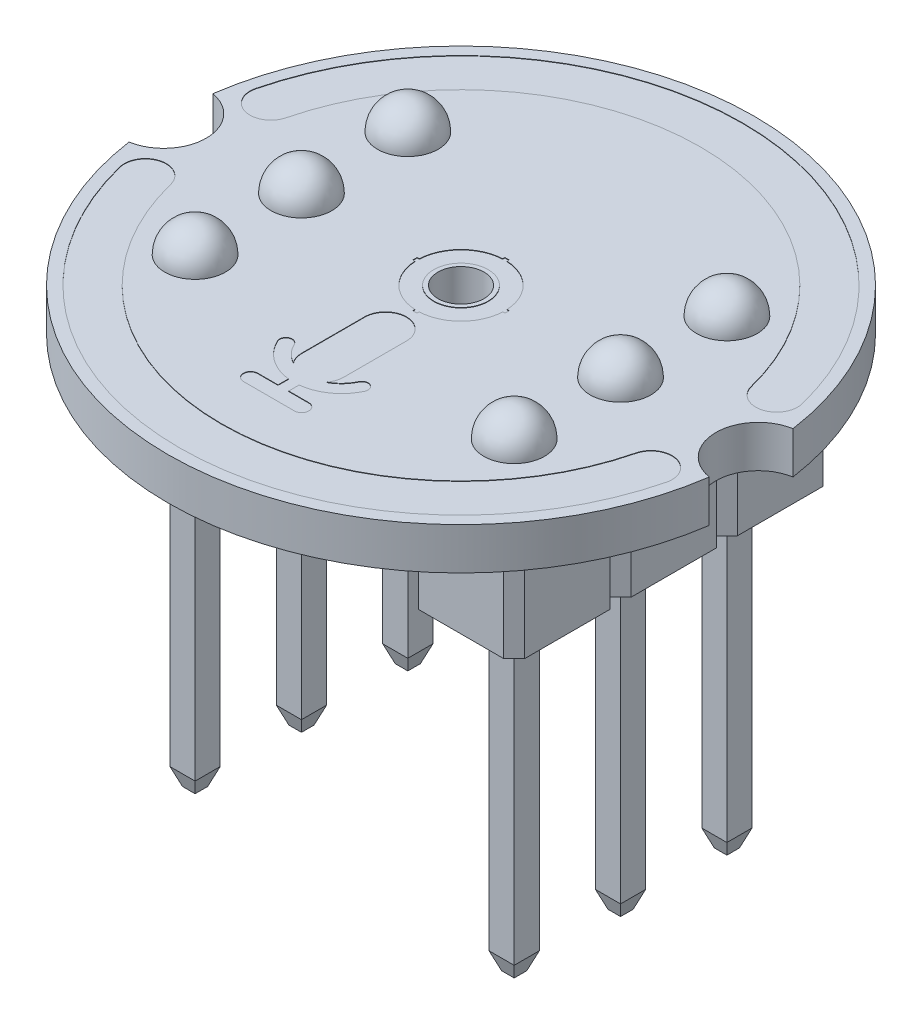
from build123d import *
from OCP.BRepFilletAPI import BRepFilletAPI_MakeChamfer

# Parameters (mm, degrees)
SKETCH_1_R          = 0.55
EXTRUDE_1_DEPTH     = 1
SKETCH_2_R          = 0.65
CUT_EXTRUDE_1_DEPTH = 0.01
SKETCH_3_R          = 0.725
EXTRUDE_2_DEPTH     = 0.725
FILLET_1_R          = 0.725
CUT_EXTRUDE_2_DEPTH = 0.01
EXTRUDE_3_DEPTH     = 2.4
SKETCH_6_W          = 1.84
SKETCH_6_H          = 0.2
CUT_EXTRUDE_3_DEPTH = 14.062009799
EXTRUDE_START       = -2.4
SKETCH_7_W          = 0.6
SKETCH_7_H          = 0.6
EXTRUDE_4_DEPTH     = 10
CHAMFER_1_SIZE      = 0.15
CHAMFER_1_SIZE2     = 0.412121613
SKETCH_9_W          = 3.75
SKETCH_9_H          = 4.75
EXTRUDE_5_DEPTH     = 0.2
FILLET_2_R          = 0.2
SKETCH_11_W         = 2.95
SKETCH_11_H         = 3.95
EXTRUDE_6_DEPTH     = 0.3
FILLET_3_R          = 0.4
SKETCH_12_W         = 1.8
SKETCH_12_H         = 0.8
EXTRUDE_7_DEPTH     = 0.6


with BuildPart() as part:
    # Эскиз1 → Бобышка-Вытянуть1 (new body)
    with BuildSketch(Plane(origin=(0, 0, 0), x_dir=(1, 0, 0), z_dir=(0, 1, 0))):
        with BuildLine():
            ThreePointArc((-6.92820323, -1), (0, -7), (6.92820323, -1))
            ThreePointArc((6.92820323, -1), (6.085350243, 0), (6.92820323, 1))
            ThreePointArc((6.92820323, 1), (0, 7), (-6.92820323, 1))
            ThreePointArc((-6.92820323, 1), (-6.085350243, 0), (-6.92820323, -1))
        make_face()
        with Locations(Location((0, 0, 0), (0, 0, 270))):
            Circle(SKETCH_1_R, mode=Mode.SUBTRACT)
    extrude(amount=EXTRUDE_1_DEPTH)

    # Эскиз2 → Вырез-Вытянуть1 (cut)
    # profile 1 of 3: a face of its own
    with BuildSketch(Plane(origin=(0, 1, 0), x_dir=(1, 0, 0), z_dir=(0, 1, 0))):
        with BuildLine():
            ThreePointArc((-6.523958913, -1.620535852), (-6.159241111, -1.014746346), (-5.553451606, -1.379464148))
            ThreePointArc((-5.553451606, -1.379464148), (0, -5.722215137), (5.553451606, -1.379464148))
            ThreePointArc((5.553451606, -1.379464148), (6.159241111, -1.014746346), (6.523958913, -1.620535852))
            ThreePointArc((6.523958913, -1.620535852), (0, -6.722215137), (-6.523958913, -1.620535852))
        make_face()
    # profile 2 of 3: a face of its own
    with BuildSketch(Plane(origin=(0, 1, 0), x_dir=(1, 0, 0), z_dir=(0, 1, 0))):
        with BuildLine():
            ThreePointArc((6.523958913, 1.620535852), (0, 6.722215137), (-6.523958913, 1.620535852))
            ThreePointArc((-6.523958913, 1.620535852), (-6.159241111, 1.014746346), (-5.553451606, 1.379464148))
            ThreePointArc((-5.553451606, 1.379464148), (0, 5.722215137), (5.553451606, 1.379464148))
            ThreePointArc((5.553451606, 1.379464148), (6.159241111, 1.014746346), (6.523958913, 1.620535852))
        make_face()
    # profile 3 of 3: a face of its own
    with BuildSketch(Plane(origin=(0, 1, 0), x_dir=(1, 0, 0), z_dir=(0, 1, 0))):
        with BuildLine():
            Line((0.05, -1.048808848), (0.05, -1.1))
            Line((0.05, -1.1), (-0.05, -1.1))
            Line((-0.05, -1.1), (-0.05, -1.048808848))
            ThreePointArc((-0.05, -1.048808848), (-0.74246212, -0.74246212), (-1.048808848, -0.05))
            Line((-1.048808848, -0.05), (-1.1, -0.05))
            Line((-1.1, -0.05), (-1.1, 0.05))
            Line((-1.1, 0.05), (-1.048808848, 0.05))
            ThreePointArc((-1.048808848, 0.05), (-0.74246212, 0.74246212), (-0.05, 1.048808848))
            Line((-0.05, 1.048808848), (-0.05, 1.1))
            Line((-0.05, 1.1), (0.05, 1.1))
            Line((0.05, 1.1), (0.05, 1.048808848))
            ThreePointArc((0.05, 1.048808848), (0.74246212, 0.74246212), (1.048808848, 0.05))
            Line((1.048808848, 0.05), (1.1, 0.05))
            Line((1.1, 0.05), (1.1, -0.05))
            Line((1.1, -0.05), (1.048808848, -0.05))
            ThreePointArc((1.048808848, -0.05), (0.74246212, -0.74246212), (0.05, -1.048808848))
        make_face()
        with Locations(Location((0, 0, 0), (0, 0, 270))):
            Circle(SKETCH_2_R, mode=Mode.SUBTRACT)
    extrude(amount=-CUT_EXTRUDE_1_DEPTH, mode=Mode.SUBTRACT)

    # Эскиз3 → Бобышка-Вытянуть2 (add)
    with BuildSketch(Plane(origin=(0, 1, 0), x_dir=(1, 0, 0), z_dir=(0, 1, 0))):
        with Locations(Location((-3.81, 2.54, 0), (0, 0, 270))):
            Circle(SKETCH_3_R)
        with Locations(Location((-3.81, 0, 0), (0, 0, 270))):
            Circle(SKETCH_3_R)
        with Locations(Location((-3.81, -2.54, 0), (0, 0, 270))):
            Circle(SKETCH_3_R)
        with Locations(Location((3.81, 2.54, 0), (0, 0, 270))):
            Circle(SKETCH_3_R)
        with Locations(Location((3.81, 0, 0), (0, 0, 270))):
            Circle(SKETCH_3_R)
        with Locations(Location((3.81, -2.54, 0), (0, 0, 270))):
            Circle(SKETCH_3_R)
    extrude(amount=EXTRUDE_2_DEPTH)

    # Скругление1
    fillet_1_edges = [part.edges().sort_by_distance(p)[0] for p in [
        (3.81, 1.725, -3.265),
        (3.81, 1.725, -0.725),
        (3.81, 1.725, 1.815),
        (-3.81, 1.725, -3.265),
        (-3.81, 1.725, -0.725),
        (-3.81, 1.725, 1.815),
    ]]
    fillet(fillet_1_edges, radius=FILLET_1_R - 0.0001)  # a hair under: the kernel refuses the full size

    # Эскиз4 → Вырез-Вытянуть2 (cut)
    with BuildSketch(Plane(origin=(0, 1, 0), x_dir=(1, 0, 0), z_dir=(0, 1, 0))):
        with BuildLine():
            Line((0.5, -1.801586057), (0.5, -3.301586057))
            ThreePointArc((0.5, -3.301586057), (0.474341649, -3.45969994), (0.4, -3.601586057))
            ThreePointArc((0.4, -3.601586057), (0.616938208, -3.436297308), (0.770361619, -3.210811579))
            ThreePointArc((0.770361619, -3.210811579), (0.969700526, -3.138258151), (1.042253955, -3.337597058))
            ThreePointArc((1.042253955, -3.337597058), (0.671106808, -3.785457382), (0.128273502, -3.994409713))
            Line((0.128273502, -3.994409713), (0.128273502, -4.243023198))
            Line((0.128273502, -4.243023198), (0.609065466, -4.243023198))
            ThreePointArc((0.609065466, -4.243023198), (0.780812385, -4.414770118), (0.609065466, -4.586517038))
            Line((0.609065466, -4.586517038), (-0.609065466, -4.586517038))
            ThreePointArc((-0.609065466, -4.586517038), (-0.780812385, -4.414770118), (-0.609065466, -4.243023198))
            Line((-0.609065466, -4.243023198), (-0.125837725, -4.243023198))
            Line((-0.125837725, -4.243023198), (-0.125837725, -3.994680483))
            ThreePointArc((-0.125837725, -3.994680483), (-0.670111334, -3.786171954), (-1.042253955, -3.337597058))
            ThreePointArc((-1.042253955, -3.337597058), (-0.969700526, -3.138258151), (-0.770361619, -3.210811579))
            ThreePointArc((-0.770361619, -3.210811579), (-0.616938208, -3.436297308), (-0.4, -3.601586057))
            ThreePointArc((-0.4, -3.601586057), (-0.474341649, -3.45969994), (-0.5, -3.301586057))
            Line((-0.5, -3.301586057), (-0.5, -1.801586057))
            ThreePointArc((-0.5, -1.801586057), (0, -1.301586057), (0.5, -1.801586057))
        make_face()
    extrude(amount=-CUT_EXTRUDE_2_DEPTH, mode=Mode.SUBTRACT)

    # Эскиз5 → Бобышка-Вытянуть3 (add)
    with BuildSketch(Plane.XZ):
        Polygon((-5.08, 3.56), (-4.83, 3.81), (-2.79, 3.81), (-2.54, 3.56), (-2.54, 1.52), (-2.79, 1.27), (-2.54, 1.02), (-2.54, -1.02), (-2.79, -1.27), (-2.54, -1.52), (-2.54, -3.56), (-2.79, -3.81), (-4.83, -3.81), (-5.08, -3.56), (-5.08, -1.52), (-4.83, -1.27), (-5.08, -1.02), (-5.08, 1.02), (-4.83, 1.27), (-5.08, 1.52), align=None)
        Polygon((2.54, 3.56), (2.54, 1.52), (2.79, 1.27), (2.54, 1.02), (2.54, -1.02), (2.79, -1.27), (2.54, -1.52), (2.54, -3.56), (2.79, -3.81), (4.83, -3.81), (5.08, -3.56), (5.08, -1.52), (4.83, -1.27), (5.08, -1.02), (5.08, 1.02), (4.83, 1.27), (5.08, 1.52), (5.08, 3.56), (4.83, 3.81), (2.79, 3.81), align=None)
    extrude(amount=EXTRUDE_3_DEPTH)

    # Эскиз6 → Вырез-Вытянуть3 (cut, through all)
    with BuildSketch(Plane.XY.offset(3.81)):
        with Locations((-3.81, -0.1)):
            Rectangle(SKETCH_6_W, SKETCH_6_H)
        with Locations((3.81, -0.1)):
            Rectangle(SKETCH_6_W, SKETCH_6_H)
    extrude(amount=-CUT_EXTRUDE_3_DEPTH, mode=Mode.SUBTRACT)

    # Эскиз7 → Бобышка-Вытянуть4 (add)
    with BuildSketch(Plane.XZ.offset(2.4).offset(EXTRUDE_START)):
        with Locations((-3.81, 2.54)):
            Rectangle(SKETCH_7_W, SKETCH_7_H)
        with Locations((3.81, 2.54)):
            Rectangle(SKETCH_7_W, SKETCH_7_H)
        with Locations((3.81, 0)):
            Rectangle(SKETCH_7_W, SKETCH_7_H)
        with Locations((3.81, -2.54)):
            Rectangle(SKETCH_7_W, SKETCH_7_H)
        with Locations((-3.81, 0)):
            Rectangle(SKETCH_7_W, SKETCH_7_H)
        with Locations((-3.81, -2.54)):
            Rectangle(SKETCH_7_W, SKETCH_7_H)
    extrude(amount=EXTRUDE_4_DEPTH)

    # Фаска1: one chamfer whose edges measure the first distance from different faces: ONE call of the kernel's chamfer builder (chamfer() names one face for all edges)
    chamfer_1_edges_1 = [part.edges().sort_by_distance(p)[0] for p in [
        (-3.81, -10, 2.24),
        (-4.11, -10, 2.54),
        (-3.81, -10, 2.84),
        (-3.51, -10, 2.54),
    ]]
    chamfer_1_side_1 = [part.faces().sort_by_distance(p)[0] for p in [
        (-3.81, -10, 2.54),
    ]]
    chamfer_1_edges_2 = [part.edges().sort_by_distance(p)[0] for p in [
        (3.51, -10, 2.54),
        (3.81, -10, 2.84),
        (4.11, -10, 2.54),
        (3.81, -10, 2.24),
    ]]
    chamfer_1_side_2 = [part.faces().sort_by_distance(p)[0] for p in [
        (3.81, -10, 2.54),
    ]]
    chamfer_1_edges_3 = [part.edges().sort_by_distance(p)[0] for p in [
        (3.51, -10, 0),
        (3.81, -10, 0.3),
        (4.11, -10, 0),
        (3.81, -10, -0.3),
    ]]
    chamfer_1_side_3 = [part.faces().sort_by_distance(p)[0] for p in [
        (3.81, -10, 0),
    ]]
    chamfer_1_edges_4 = [part.edges().sort_by_distance(p)[0] for p in [
        (3.51, -10, -2.54),
        (3.81, -10, -2.24),
        (4.11, -10, -2.54),
        (3.81, -10, -2.84),
    ]]
    chamfer_1_side_4 = [part.faces().sort_by_distance(p)[0] for p in [
        (3.81, -10, -2.54),
    ]]
    chamfer_1_edges_5 = [part.edges().sort_by_distance(p)[0] for p in [
        (-4.11, -10, 0),
        (-3.81, -10, 0.3),
        (-3.51, -10, 0),
        (-3.81, -10, -0.3),
    ]]
    chamfer_1_side_5 = [part.faces().sort_by_distance(p)[0] for p in [
        (-3.81, -10, 0),
    ]]
    chamfer_1_edges_6 = [part.edges().sort_by_distance(p)[0] for p in [
        (-4.11, -10, -2.54),
        (-3.81, -10, -2.24),
        (-3.51, -10, -2.54),
        (-3.81, -10, -2.84),
    ]]
    chamfer_1_side_6 = [part.faces().sort_by_distance(p)[0] for p in [
        (-3.81, -10, -2.54),
    ]]
    chamfer_1 = BRepFilletAPI_MakeChamfer(part.part.solid().wrapped)
    for e in chamfer_1_edges_1:
        chamfer_1.Add(CHAMFER_1_SIZE, CHAMFER_1_SIZE2, e.wrapped, chamfer_1_side_1[0].wrapped)  # the first distance lies on this face
    for e in chamfer_1_edges_2:
        chamfer_1.Add(CHAMFER_1_SIZE, CHAMFER_1_SIZE2, e.wrapped, chamfer_1_side_2[0].wrapped)  # the first distance lies on this face
    for e in chamfer_1_edges_3:
        chamfer_1.Add(CHAMFER_1_SIZE, CHAMFER_1_SIZE2, e.wrapped, chamfer_1_side_3[0].wrapped)  # the first distance lies on this face
    for e in chamfer_1_edges_4:
        chamfer_1.Add(CHAMFER_1_SIZE, CHAMFER_1_SIZE2, e.wrapped, chamfer_1_side_4[0].wrapped)  # the first distance lies on this face
    for e in chamfer_1_edges_5:
        chamfer_1.Add(CHAMFER_1_SIZE, CHAMFER_1_SIZE2, e.wrapped, chamfer_1_side_5[0].wrapped)  # the first distance lies on this face
    for e in chamfer_1_edges_6:
        chamfer_1.Add(CHAMFER_1_SIZE, CHAMFER_1_SIZE2, e.wrapped, chamfer_1_side_6[0].wrapped)  # the first distance lies on this face
    add(Compound.cast(chamfer_1.Shape()), mode=Mode.REPLACE)

    # Эскиз9 → Бобышка-Вытянуть5 (add)
    with BuildSketch(Plane.XZ):
        with Locations((0, 1.425)):
            Rectangle(SKETCH_9_W, SKETCH_9_H)
    extrude(amount=EXTRUDE_5_DEPTH)

    # Скругление2
    fillet_2_edges = [part.edges().sort_by_distance(p)[0] for p in [
        (1.875, -0.1, -0.95),
        (1.875, -0.1, 3.8),
        (-1.875, -0.1, 3.8),
        (-1.875, -0.1, -0.95),
    ]]
    fillet(fillet_2_edges, radius=FILLET_2_R)

    # Эскиз11 → Бобышка-Вытянуть6 (add)
    with BuildSketch(Plane.XZ.offset(0.2)):
        with Locations((0, 1.425)):
            Rectangle(SKETCH_11_W, SKETCH_11_H)
    extrude(amount=EXTRUDE_6_DEPTH)

    # Скругление3
    fillet_3_edges = [part.edges().sort_by_distance(p)[0] for p in [
        (1.475, -0.35, -0.55),
        (1.475, -0.35, 3.4),
        (-1.475, -0.35, 3.4),
        (-1.475, -0.35, -0.55),
    ]]
    fillet(fillet_3_edges, radius=FILLET_3_R)

    # Эскиз12 → Бобышка-Вытянуть7 (add)
    with BuildSketch(Plane.XZ):
        with Locations((0, -3.082172511)):
            Rectangle(SKETCH_12_W, SKETCH_12_H)
        with Locations((0, -4.3)):
            Rectangle(SKETCH_12_W, SKETCH_12_H)
    extrude(amount=EXTRUDE_7_DEPTH)


solid = part.part
